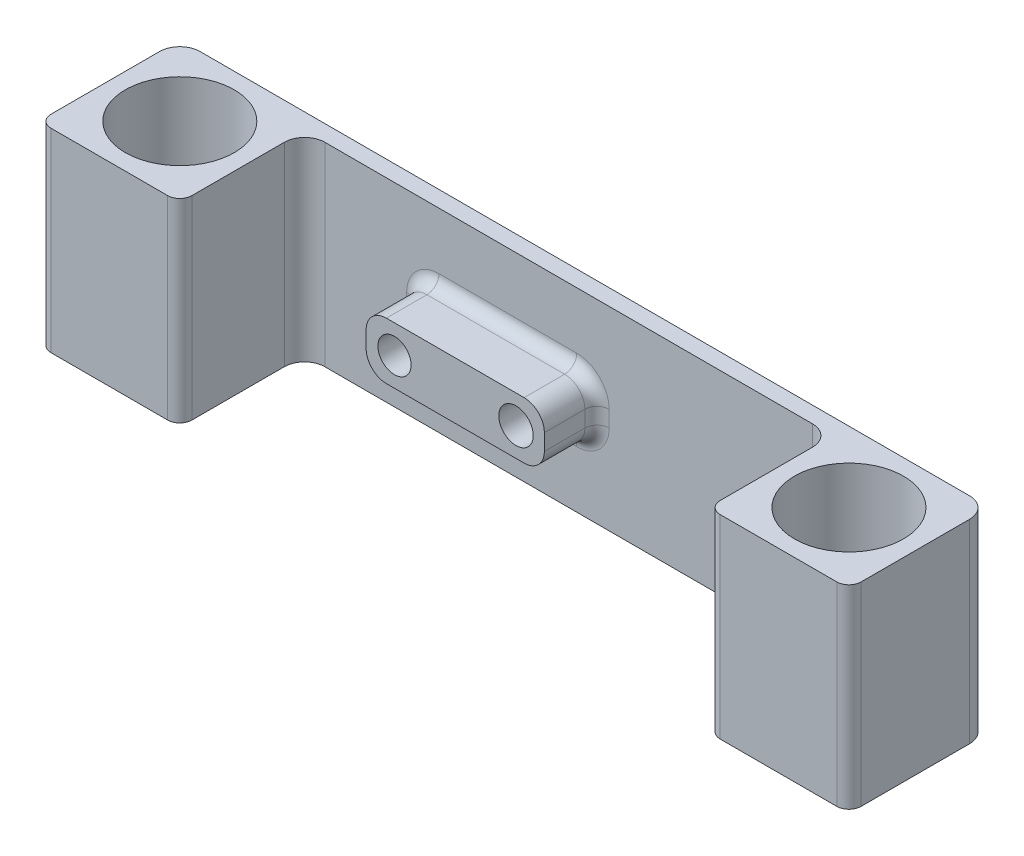
from build123d import *

# Parameters (mm, degrees)
SKETCH1_R           = 13.45
BOSS_EXTRUDE2_DEPTH = 48
SKETCH7_W           = 44
SKETCH7_H           = 14
SKETCH7_R           = 4.25
SKETCH7_R_2         = 4.1
BOSS_EXTRUDE3_DEPTH = 13
FILLET1_R           = 3
FILLET2_R           = 5
FILLET3_R           = 5
FILLET4_R           = 3
SKETCH8_R           = 4.1
SKETCH8_R_2         = 4.25
CUT_EXTRUDE1_DEPTH  = 192.299242027


with BuildPart() as part:
    # Sketch1 → Boss-Extrude2 (new body)
    with BuildSketch(Plane(origin=(0, 0, 0), x_dir=(1, 0, 0), z_dir=(0, 1, 0))):
        Polygon((-17.4, 17.4), (17.4, 17.4), (17.4, -17.4), (-17.4, -17.4), (-17.4, 13.4), (-82.6, 13.4), (-82.6, 17.4), align=None)
        Circle(SKETCH1_R, mode=Mode.SUBTRACT)
    boss_extrude2 = extrude(amount=BOSS_EXTRUDE2_DEPTH)

    # Mirror2: Boss-Extrude2 across plane
    add(boss_extrude2.mirror(Plane(origin=(-82.6, 48, -17.4), x_dir=(0, 0, 1), z_dir=(1, 0, 0))))

    # Sketch7 → Boss-Extrude3 (add)
    with BuildSketch(Plane.XY.offset(-13.4)):
        with Locations((-97.6, 24)):
            Rectangle(SKETCH7_W, SKETCH7_H)
        with Locations((-82.6, 24)):
            Circle(SKETCH7_R, mode=Mode.SUBTRACT)
        with Locations((-112.6, 24)):
            Circle(SKETCH7_R_2, mode=Mode.SUBTRACT)
    extrude(amount=BOSS_EXTRUDE3_DEPTH)

    # Fillet1
    fillet1_edges = [part.edges().sort_by_distance(p)[0] for p in [
        (17.4, 24, 17.4),
        (-17.4, 24, 17.4),
        (-182.6, 24, 17.4),
        (-147.8, 24, 17.4),
    ]]
    fillet(fillet1_edges, radius=FILLET1_R)

    # Fillet2
    fillet2_edges = [part.edges().sort_by_distance(p)[0] for p in [
        (17.4, 24, -17.4),
        (-17.4, 24, -13.4),
        (-182.6, 24, -17.4),
        (-147.8, 24, -13.4),
    ]]
    fillet(fillet2_edges, radius=FILLET2_R)

    # Fillet3
    fillet3_edges = [part.edges().sort_by_distance(p)[0] for p in [
        (-75.6, 31, -6.9),
        (-75.6, 17, -6.9),
        (-119.6, 31, -6.9),
        (-119.6, 17, -6.9),
    ]]
    fillet(fillet3_edges, radius=FILLET3_R)

    # Fillet4
    fillet4_edges = [part.edges().sort_by_distance(p)[0] for p in [
        (-118.135533906, 18.464466094, -13.4),
        (-119.6, 24, -13.4),
        (-118.135533906, 29.535533906, -13.4),
        (-97.6, 31, -13.4),
        (-77.064466094, 29.535533906, -13.4),
        (-75.6, 24, -13.4),
        (-77.064466094, 18.464466094, -13.4),
        (-97.6, 17, -13.4),
    ]]
    fillet(fillet4_edges, radius=FILLET4_R)

    # Sketch8 → Cut-Extrude1 (cut, through all)
    with BuildSketch(Plane.XY.offset(-13.4)):
        with Locations((-112.6, 24)):
            Circle(SKETCH8_R)
        with Locations((-82.6, 24)):
            Circle(SKETCH8_R_2)
    extrude(amount=-CUT_EXTRUDE1_DEPTH, mode=Mode.SUBTRACT)


solid = part.part
